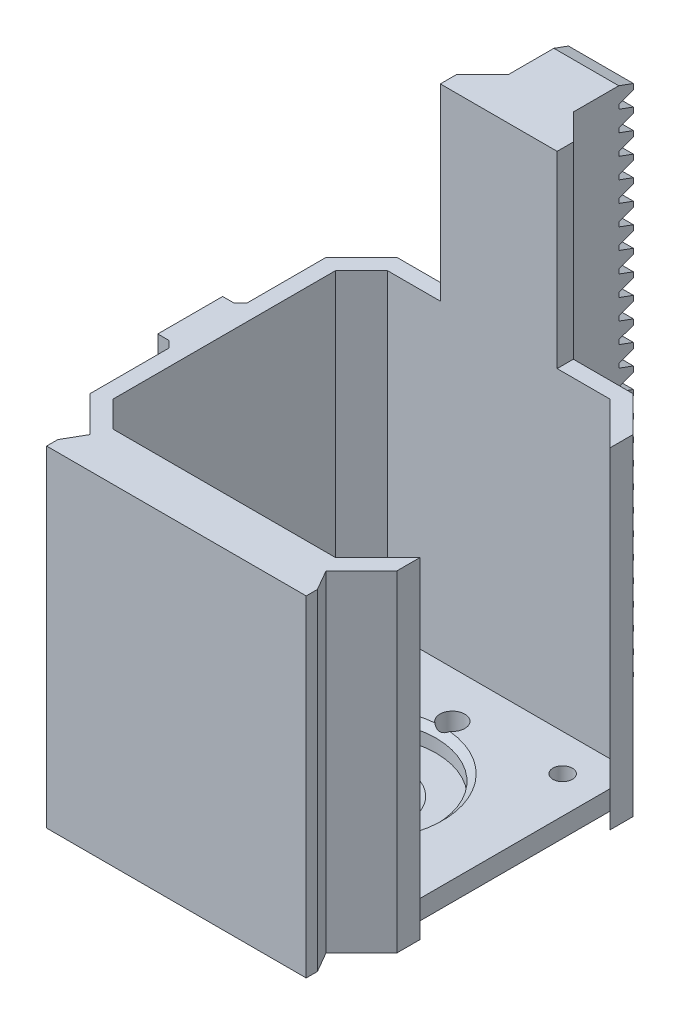
from build123d import *

# Parameters (mm, degrees)
SKETCH1_R               = 1.5000000000000009
SKETCH1_R_2             = 11.5
BOSS_EXTRUDE1_DEPTH     = 3
BOSS_EXTRUDE2_DEPTH     = 51
BOSS_EXTRUDE3_DEPTH     = 51
BOSS_EXTRUDE4_DEPTH     = 5
BOSS_EXTRUDE6_DEPTH     = 10
CHAMFER1_SIZE           = 4
BOSS_EXTRUDE7_DEPTH     = 29
BOSS_EXTRUDE8_DEPTH     = 4
CHAMFER2_SIZE           = 1
CHAMFER3_SIZE           = 1
BOSS_EXTRUDE9_START     = 4
BOSS_EXTRUDE9_DEPTH     = 4
SKETCH18_R              = 6
SKETCH18_R_2            = 1.925
SKETCH18_R_3            = 1.9249999999999998
CUT_EXTRUDE1_DEPTH      = 96.47025714849626
CHAMFER4_SIZE           = 4
CHAMFER5_SIZE           = 0.75
CHAMFER6_SIZE           = 1
CUT_EXTRUDE2_DEPTH      = 29
CUT_EXTRUDE3_DEPTH      = 72.29915855744723
CUT_EXTRUDE3_DEPTH_BACK = 72.29915855744723


# Some blends are built 0.0001 mm under size
with BuildPart() as part:
    # Sketch1 → Boss-Extrude1 (new body)
    with BuildSketch(Plane(origin=(0, 0, 0), x_dir=(1, 0, 0), z_dir=(0, 1, 0))):
        Polygon((-21.14999999999999, 17.15), (-17.14999999999999, 21.15), (17.150000000000006, 21.15), (21.150000000000006, 17.15), (21.150000000000006, -17.15), (17.150000000000006, -21.15), (-17.14999999999999, -21.15), (-21.14999999999999, -17.15), align=None)
        with Locations(Location((-15.499999999999975, 15.499999999999993, 0), (0, 0, 270))):
            Circle(SKETCH1_R, mode=Mode.SUBTRACT)
        with Locations(Location((15.500000000000025, 15.499999999999996, 0), (0, 0, 270))):
            Circle(SKETCH1_R, mode=Mode.SUBTRACT)
        with Locations(Location((15.499999999999975, -15.499999999999982, 0), (0, 0, 270))):
            Circle(SKETCH1_R, mode=Mode.SUBTRACT)
        with Locations(Location((-15.499999999999972, -15.499999999999982, 0), (0, 0, 270))):
            Circle(SKETCH1_R, mode=Mode.SUBTRACT)
        with Locations(Location((1.041e-14, -3.47e-15, 0), (0, 0, 270))):
            Circle(SKETCH1_R_2, mode=Mode.SUBTRACT)
    extrude(amount=BOSS_EXTRUDE1_DEPTH)

    # Sketch5 → Boss-Extrude2 (add)
    with BuildSketch(Plane(origin=(0, 0, 0), x_dir=(1, 0, 0), z_dir=(0, 1, 0))):
        Polygon((21.150000000000006, -17.15), (23.650000000000006, -14.64999999999999), (23.650000000000006, -18.18553390593274), (18.185533905932747, -23.65), (-18.185533905932733, -23.65), (-23.64999999999999, -18.18553390593274), (-23.64999999999999, 14.649999999999958), (-23.64999999999999, 18.18553390593274), (-18.185533905932733, 23.65), (18.185533905932747, 23.65), (23.650000000000006, 18.18553390593274), (23.650000000000006, 14.65), (21.150000000000006, 17.15), (17.150000000000006, 21.15), (-17.14999999999999, 21.15), (-21.14999999999999, 17.15), (-21.14999999999999, -17.15), (-17.14999999999999, -21.15), (17.150000000000006, -21.15), align=None)
    extrude(amount=BOSS_EXTRUDE2_DEPTH)

    # Sketch9 → Boss-Extrude3 (add)
    with BuildSketch(Plane(origin=(0, 0, 0), x_dir=(1, 0, 0), z_dir=(0, 1, 0))):
        Polygon((-18.185533905932733, -23.65), (-20.99999999999999, -28.524798271104366), (21.00000000000001, -28.524798271104366), (18.185533905932747, -23.65), align=None)
    extrude(amount=BOSS_EXTRUDE3_DEPTH)

    # Sketch11 → Boss-Extrude4 (add, symmetric)
    with BuildSketch(Plane(origin=(0, 0, 0), x_dir=(0, 0, -1), z_dir=(1, 0, 0))):
        Polygon((23.65, 51), (24.65, 51), (24.650000000000006, 0), (23.650000000000006, 0), align=None)
    extrude(amount=BOSS_EXTRUDE4_DEPTH, both=True)

    # Sketch13 → Boss-Extrude6 (add)
    with BuildSketch(Plane(origin=(5, 0, 0), x_dir=(0, 0, -1), z_dir=(1, 0, 0))):
        Polygon((24.650000000000006, 80), (34.650000000000006, 80), (36.900000000000006, 79.18106700000001), (36.900000000000006, 78.3382111), (34.650000000000006, 77.51927810000001), (34.650000000000006, 76.8584073), (36.900000000000006, 76.03947430000001), (36.900000000000006, 75.1966185), (34.650000000000006, 74.3776854), (34.650000000000006, 73.7168147), (36.900000000000006, 72.8978817), (36.900000000000006, 72.05502580000001), (34.650000000000006, 71.23609280000001), (34.650000000000006, 70.57522200000002), (36.900000000000006, 69.75628900000002), (36.900000000000006, 68.91343320000003), (34.650000000000006, 68.09450010000002), (34.650000000000006, 67.43362940000003), (36.900000000000006, 66.61469640000003), (36.900000000000006, 65.77184050000002), (34.650000000000006, 64.95290750000004), (34.650000000000006, 64.29203670000003), (36.900000000000006, 63.47310370000003), (36.900000000000006, 62.63024780000003), (34.650000000000006, 61.811314800000034), (34.650000000000006, 61.15044410000004), (36.900000000000006, 60.33151110000004), (36.900000000000006, 59.488655200000046), (34.650000000000006, 58.66972220000005), (34.650000000000006, 58.00885140000006), (36.900000000000006, 57.18991840000007), (36.900000000000006, 56.34706250000007), (34.650000000000006, 55.52812950000008), (34.650000000000006, 54.86725880000008), (36.900000000000006, 54.04832570000008), (36.900000000000006, 53.20546990000009), (34.650000000000006, 52.38653690000009), (34.650000000000006, 51.72566610000008), (36.900000000000006, 50.90673310000009), (36.900000000000006, 50.063877200000086), (34.650000000000006, 49.244944200000084), (34.650000000000006, 48.58407350000008), (36.900000000000006, 47.765140400000085), (36.900000000000006, 46.922284600000076), (34.650000000000006, 46.10335160000008), (34.650000000000006, 45.442480800000084), (36.900000000000006, 44.62354780000008), (36.900000000000006, 43.780691900000086), (34.650000000000006, 42.961758900000085), (34.650000000000006, 42.30088820000009), (36.900000000000006, 41.481955100000086), (36.900000000000006, 40.63909930000008), (34.650000000000006, 39.82016620000009), (34.650000000000006, 39.15929550000008), (36.900000000000006, 38.340362500000076), (36.900000000000006, 37.49750660000009), (34.650000000000006, 36.678573600000085), (34.650000000000006, 36.01770280000009), (36.900000000000006, 35.198769800000086), (36.900000000000006, 34.355914000000084), (34.650000000000006, 33.53698090000009), (34.650000000000006, 32.876110200000085), (36.900000000000006, 32.05717720000008), (36.900000000000006, 31.214321300000083), (34.650000000000006, 30.395388300000082), (34.650000000000006, 29.734517500000084), (36.900000000000006, 28.915584500000083), (36.900000000000006, 28.072728700000084), (34.650000000000006, 27.253795600000082), (34.650000000000006, 26.592924900000085), (36.900000000000006, 25.773991900000084), (36.900000000000006, 24.931136000000084), (34.650000000000006, 24.112203000000083), (34.650000000000006, 23.451332200000085), (36.900000000000006, 22.632399200000084), (36.900000000000006, 21.789543400000085), (34.650000000000006, 20.970610300000082), (34.650000000000006, 20.309739600000086), (36.900000000000006, 19.490806600000084), (36.900000000000006, 18.647950700000088), (34.650000000000006, 17.829017700000087), (34.650000000000006, 17.168146900000085), (36.900000000000006, 16.34921390000009), (36.900000000000006, 15.506358000000095), (34.650000000000006, 14.687425000000086), (34.650000000000006, 14.026554300000091), (36.900000000000006, 13.207621200000089), (36.900000000000006, 12.364765400000074), (34.650000000000006, 11.54583240000008), (34.650000000000006, 10.884961600000075), (36.900000000000006, 10.066028600000083), (36.900000000000006, 9.223172700000088), (34.650000000000006, 8.404239700000094), (34.650000000000006, 7.743369000000083), (36.900000000000006, 6.924435900000095), (36.900000000000006, 6.081580100000081), (34.650000000000006, 5.262647100000073), (34.650000000000006, 4.601776300000083), (36.900000000000006, 3.7828433000000743), (36.900000000000006, 2.939987400000094), (34.650000000000006, 2.121054400000086), (34.650000000000006, 1.4601837000000895), (36.900000000000006, 0.6412506000000873), (36.900000000000006, 0), (24.650000000000006, -1.5e-15), align=None)
    extrude(amount=-BOSS_EXTRUDE6_DEPTH)

    # Chamfer1
    chamfer1_edges = [part.edges().sort_by_distance(p)[0] for p in [
        (5, 25.5, -23.650000000000002),
    ]]
    chamfer(chamfer1_edges, length=CHAMFER1_SIZE)
    chamfer1_2_edges = [part.edges().sort_by_distance(p)[0] for p in [
        (-5, 25.5, -23.650000000000002),
    ]]
    chamfer(chamfer1_2_edges, length=CHAMFER1_SIZE)

    # Sketch15 → Boss-Extrude7 (add)
    with BuildSketch(Plane(origin=(0, 51, 0), x_dir=(1, 0, 0), z_dir=(0, 1, 0))):
        Polygon((-8.000000000000007, 24.650000000000006), (-11.499999999999995, 21.15), (11.500000000000005, 21.150000000000002), (8.000000000000007, 24.65), align=None)
    extrude(amount=BOSS_EXTRUDE7_DEPTH)

    # Sketch16 → Boss-Extrude8 (add)
    with BuildSketch(Plane(origin=(0, 51, 0), x_dir=(1, 0, 0), z_dir=(0, 1, 0))):
        Polygon((-23.649999999999988, -5), (-26.399999999999984, -4.999999999999999), (-26.399999999999984, 5.000000000000001), (-23.649999999999988, 5), align=None)
    extrude(amount=-BOSS_EXTRUDE8_DEPTH)

    # Chamfer2
    chamfer2_edges = [part.edges().sort_by_distance(p)[0] for p in [
        (-23.649999999999988, 47, 0),
    ]]
    chamfer(chamfer2_edges, length=CHAMFER2_SIZE)

    # Chamfer3
    chamfer3_edges = [part.edges().sort_by_distance(p)[0] for p in [
        (-23.64999999999999, 48.5, -5),
        (-23.64999999999999, 48.5, 5),
    ]]
    chamfer(chamfer3_edges, length=CHAMFER3_SIZE)

    # Sketch17 → Boss-Extrude9 (add)
    with BuildSketch(Plane.XZ.offset(BOSS_EXTRUDE9_START)):
        with BuildLine():
            Line((-7.999999999999994, 8.26135582092932), (-7.999999999999994, 10.99818166789357))
            ThreePointArc((-8.000000000000405, 10.998181667893718), (-13.599999999999989, 1.721e-14), (-8.000000000000421, -10.998181667893697))
            Line((-7.99999999999999, -10.998181667893547), (-7.99999999999999, -8.26135582092931))
            ThreePointArc((-7.999999999999868, -8.261355820929266), (-11.49999999999999, 4.88e-15), (-7.999999999999867, 8.261355820929277))
        make_face()
        with BuildLine():
            Line((-7.99999999999999, -8.26135582092931), (-7.999999999999994, 8.26135582092932))
            ThreePointArc((-7.999999999999867, 8.261355820929277), (-11.49999999999999, 4.88e-15), (-7.999999999999868, -8.261355820929266))
        make_face()
        with BuildLine():
            ThreePointArc((7.99999999999999, 8.261355820929177), (8.261e-14, 11.500000000000004), (-7.999999999999867, 8.261355820929277))
            Line((-7.999999999999994, 8.26135582092932), (-7.99999999999999, -8.26135582092931))
            ThreePointArc((-7.999999999999868, -8.261355820929266), (9.001e-14, -11.499999999999996), (7.9999999999999964, -8.261355820929163))
            Line((8.000000000000009, -8.261355820929168), (8.000000000000005, 8.26135582092918))
        make_face()
        with BuildLine():
            ThreePointArc((8.000000000000197, 10.998181667893883), (-1.3371e-13, 13.600000000000003), (-8.000000000000405, 10.998181667893718))
            Line((-7.999999999999994, 10.99818166789357), (-7.999999999999994, 8.26135582092932))
            ThreePointArc((-7.999999999999867, 8.261355820929277), (8.261e-14, 11.500000000000004), (7.99999999999999, 8.261355820929177))
            Line((8.000000000000005, 8.26135582092918), (8.000000000000005, 10.998181667893816))
        make_face()
        with BuildLine():
            Line((-7.99999999999999, -8.26135582092931), (-7.99999999999999, -10.998181667893547))
            ThreePointArc((-8.000000000000421, -10.998181667893697), (-1.3704e-13, -13.599999999999996), (8.000000000000195, -10.998181667893878))
            Line((8.000000000000009, -10.998181667893807), (8.000000000000009, -8.261355820929168))
            ThreePointArc((7.9999999999999964, -8.261355820929163), (9.001e-14, -11.499999999999996), (-7.999999999999868, -8.261355820929266))
        make_face()
        with BuildLine():
            Line((2.9999999999999707, 19.500000000000007), (-2.999999999999959, 19.500000000000007))
            ThreePointArc((-2.999999999999959, 19.500000000000007), (-6.535533905932732, 18.035533905932745), (-7.999999999999995, 14.499999999999972))
            Line((-7.999999999999995, 14.499999999999972), (-7.999999999999994, 10.99818166789357))
            ThreePointArc((-8.000000000000405, 10.998181667893718), (-1.3371e-13, 13.600000000000003), (8.000000000000197, 10.998181667893883))
            Line((8.000000000000005, 10.998181667893816), (8.000000000000005, 14.499999999999972))
            ThreePointArc((8.000000000000005, 14.499999999999972), (6.535533905932744, 18.035533905932745), (2.9999999999999707, 19.500000000000007))
        make_face()
        with BuildLine():
            ThreePointArc((11.50000000000001, 3.47e-15), (10.58890929227369, 4.486089611231607), (7.99999999999999, 8.261355820929177))
            Line((8.000000000000005, 8.26135582092918), (8.000000000000009, -8.261355820929168))
            ThreePointArc((7.9999999999999964, -8.261355820929163), (10.588909292273692, -4.486089611231597), (11.50000000000001, 6.5e-16))
        make_face()
        with BuildLine():
            ThreePointArc((13.60000000000001, 3.47e-15), (12.119405926034556, 6.170899448216506), (8.000000000000197, 10.998181667893883))
            Line((8.000000000000005, 10.998181667893816), (8.000000000000005, 8.26135582092918))
            ThreePointArc((7.99999999999999, 8.261355820929177), (10.58890929227369, 4.486089611231607), (11.50000000000001, 3.47e-15))
            ThreePointArc((11.50000000000001, 6.5e-16), (10.588909292273692, -4.486089611231597), (7.9999999999999964, -8.261355820929163))
            Line((8.000000000000009, -8.261355820929168), (8.000000000000009, -10.998181667893807))
            ThreePointArc((8.000000000000195, -10.998181667893878), (12.119405926034554, -6.170899448216502), (13.60000000000001, 1.4e-16))
        make_face()
        with BuildLine():
            ThreePointArc((8.000000000000195, -10.998181667893878), (-1.3704e-13, -13.599999999999996), (-8.000000000000421, -10.998181667893697))
            Line((-7.99999999999999, -10.998181667893547), (-7.999999999999989, -14.499999999999957))
            ThreePointArc((-7.999999999999989, -14.499999999999957), (-6.535533905932728, -18.03553390593273), (-2.9999999999999547, -19.499999999999993))
            Line((-2.9999999999999543, -19.499999999999993), (2.999999999999973, -19.499999999999993))
            ThreePointArc((2.9999999999999734, -19.499999999999993), (6.535533905932747, -18.03553390593273), (8.000000000000009, -14.499999999999957))
            Line((8.000000000000009, -14.499999999999957), (8.000000000000009, -10.998181667893807))
        make_face()
    extrude(amount=-BOSS_EXTRUDE9_DEPTH)

    # Sketch18 → Cut-Extrude1 (cut, through all)
    with BuildSketch(Plane.XZ.offset(4)):
        with Locations(Location((0, 0, 0), (0, 0, 270))):
            Circle(SKETCH18_R)
        with Locations(Location((0, 14, 0), (0, 0, 270))):
            Circle(SKETCH18_R_2)
        with Locations(Location((0, -14, 0), (0, 0, 270))):
            Circle(SKETCH18_R_3)
    extrude(amount=-CUT_EXTRUDE1_DEPTH, mode=Mode.SUBTRACT)

    # Chamfer4
    chamfer4_edges = [part.edges().sort_by_distance(p)[0] for p in [
        (-13.599999999999987, 0, 1.021e-14),
        (-7.999999999999989, 0, -12.749090833946752),
        (-6.535533905932728, 0, -18.03553390593273),
        (9.33e-15, 0, -19.499999999999993),
        (8.000000000000009, 0, -12.749090833946882),
        (6.535533905932747, 0, -18.03553390593273),
        (-7.999999999999995, 0, 12.74909083394677),
        (-6.535533905932732, 0, 18.035533905932745),
        (5.77e-15, 0, 19.500000000000007),
        (8.000000000000012, 0, 12.74909083394691),
        (6.535533905932744, 0, 18.035533905932745),
        (13.60000000000002, 0, 1.2124e-13),
    ]]
    chamfer(chamfer4_edges, length=CHAMFER4_SIZE - 0.0001)  # a hair under: the kernel refuses the full size

    # Chamfer5
    chamfer5_edges = [part.edges().sort_by_distance(p)[0] for p in [
        (-15.499999999999975, 0, -16.999999999999993),
        (15.500000000000025, 0, -16.999999999999996),
        (15.499999999999975, 0, 13.999999999999982),
        (-15.499999999999972, 0, 13.999999999999982),
    ]]
    chamfer(chamfer5_edges, length=CHAMFER5_SIZE)

    # Chamfer6
    # the kernel refuses this chamfer: 1 mm, written as the material it takes off along each edge
    with BuildSketch(Plane(origin=(1.041e-14, 3, 3.47e-15), x_dir=(-1.8e-16, 0, 1), z_dir=(-1, 0, -1.8e-16))) as chamfer6_piece_1:
        Polygon((11.5 + CHAMFER6_SIZE, 0), (11.5, -CHAMFER6_SIZE), (11.5, 0), align=None)
    revolve(axis=Axis((1.041e-14, 3, 3.47e-15), (0, 1, 0)), mode=Mode.SUBTRACT)
    with BuildSketch(Plane(origin=(0, 0, 0), x_dir=(-1.8e-16, 0, -1), z_dir=(-1, 0, 1.8e-16))) as chamfer6_piece_2:
        Polygon((6, CHAMFER6_SIZE), (6 + CHAMFER6_SIZE, 0), (6, 0), align=None)
    revolve(axis=Axis((0, 0, 0), (0, -1, 0)), mode=Mode.SUBTRACT)
    with BuildSketch(Plane(origin=(0, -4, 0), x_dir=(-1.8e-16, 0, -1), z_dir=(-1, 0, 1.8e-16))) as chamfer6_piece_3:
        Polygon((6 + CHAMFER6_SIZE, 0), (6, -CHAMFER6_SIZE), (6, 0), align=None)
    revolve(axis=Axis((0, -4, 0), (0, -1, 0)), mode=Mode.SUBTRACT)

    # Sketch19 → Cut-Extrude2 (cut)
    with BuildSketch(Plane(origin=(0, 80, 0), x_dir=(1, 0, 0), z_dir=(0, 1, 0))):
        Polygon((-9.000000000000032, 23.65), (-9.000000000000032, 21.15), (-11.499999999999995, 21.15), align=None)
        Polygon((9.000000000000005, 23.65), (9.000000000000005, 21.150000000000002), (11.500000000000005, 21.150000000000002), align=None)
    extrude(amount=-CUT_EXTRUDE2_DEPTH, mode=Mode.SUBTRACT)

    # Sketch22 → Cut-Extrude3 (cut, two sides: drawn at the far end of the back side and taken through both)
    with BuildSketch(Plane(origin=(0, 51, 0), x_dir=(1, 0, 0), z_dir=(0, 1, 0)).offset(-CUT_EXTRUDE3_DEPTH_BACK)):
        Polygon((-19.99999999999997, -28.524798271104377), (-19.999999999999968, -26.792747463535505), (-20.999999999999975, -28.524798271104377), (-20.99999999999997, -29.024798271104377), (20.99999999999997, -29.024798271104377), (20.999999999999975, -28.524798271104377), (19.999999999999968, -26.792747463535505), (19.99999999999997, -28.524798271104377), align=None)
    extrude(amount=CUT_EXTRUDE3_DEPTH + CUT_EXTRUDE3_DEPTH_BACK, mode=Mode.SUBTRACT)


solid = part.part
